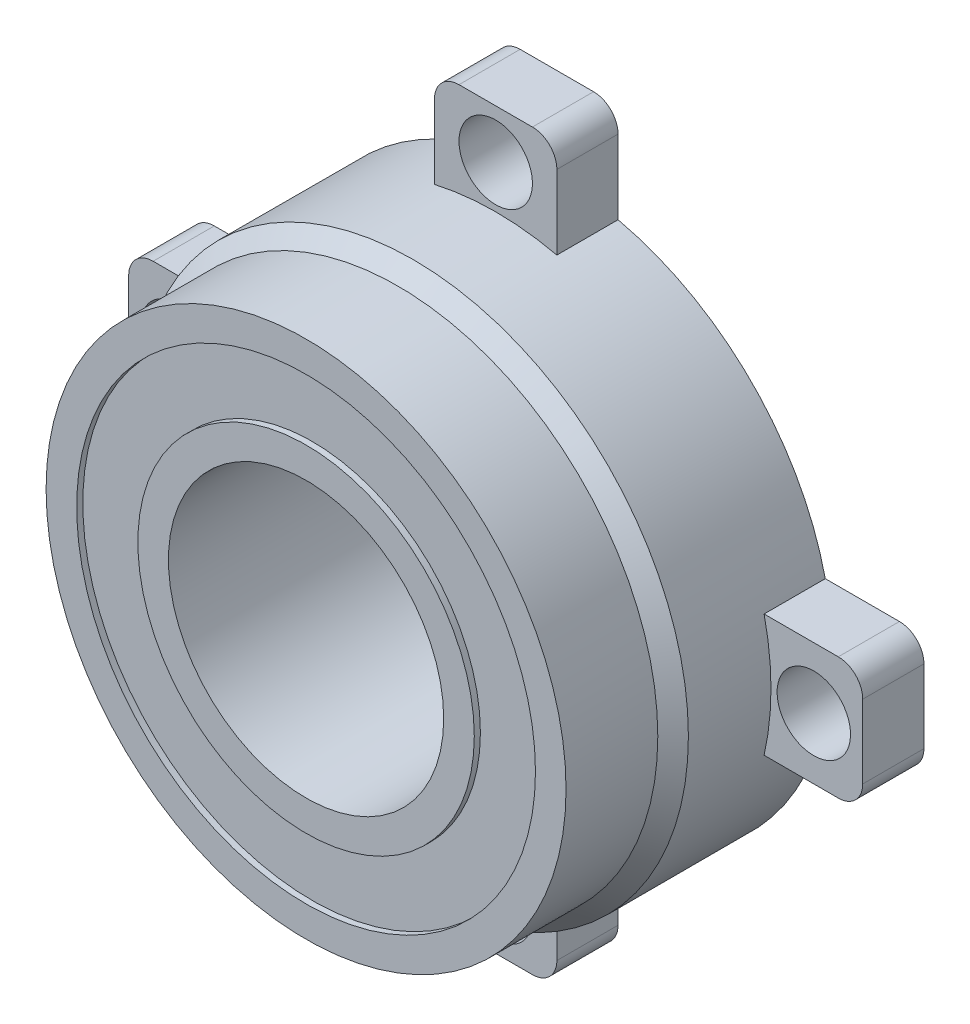
from build123d import *

# Parameters (mm, degrees)
SZKIC1_R                    = 45
SZKIC1_R_2                  = 22.5
DODANIE_WYCI_GNI_CIE1_DEPTH = 41
DODANIE_WYCI_GNI_CIE2_DEPTH = 10
SZKIC3_R                    = 6
WYTNIJ_WYCI_GNI_CIE1_DEPTH  = 10
SZYK_KO_OWY1_COUNT          = 4
WYTNIJ_WYCI_GNI_CIE2_START  = -20
SZKIC5_R                    = 45
SZKIC5_R_2                  = 42.5
WYTNIJ_WYCI_GNI_CIE2_DEPTH  = 20
SZKIC6_R                    = 37.5
SZKIC6_R_2                  = 27.5
WYTNIJ_WYCI_GNI_CIE3_DEPTH  = 1
SFAZOWANIE1_SIZE            = 5


with BuildPart() as part:
    # Szkic1 → Dodanie-wyciągnięcie1 (new body)
    with BuildSketch(Plane.XY):
        Circle(SZKIC1_R)
        Circle(SZKIC1_R_2, mode=Mode.SUBTRACT)
    extrude(amount=DODANIE_WYCI_GNI_CIE1_DEPTH)

    # Szkic2 → Dodanie-wyciągnięcie2 (add)
    with BuildSketch(Plane(origin=(0, 0, 0), x_dir=(-1, 0, 0), z_dir=(0, 0, -1))):
        with BuildLine():
            Line((35, 10), (56, 10))
            ThreePointArc((56, 10), (58.828427125, 8.828427125), (60, 6))
            Line((60, 6), (60, -6))
            ThreePointArc((60, -6), (58.828427125, -8.828427125), (56, -10))
            Line((56, -10), (35, -10))
            Line((35, -10), (35, 10))
        make_face()
        with BuildLine():
            Line((-10, 35), (10, 35))
            Line((10, 35), (10, 56))
            ThreePointArc((10, 56), (8.828427125, 58.828427125), (6, 60))
            Line((6, 60), (-6, 60))
            ThreePointArc((-6, 60), (-8.828427125, 58.828427125), (-10, 56))
            Line((-10, 56), (-10, 35))
        make_face()
        with BuildLine():
            Line((10, -35), (10, -56))
            ThreePointArc((10, -56), (8.828427125, -58.828427125), (6, -60))
            Line((6, -60), (-6, -60))
            ThreePointArc((-6, -60), (-8.828427125, -58.828427125), (-10, -56))
            Line((-10, -56), (-10, -35))
            Line((-10, -35), (10, -35))
        make_face()
        with BuildLine():
            Line((-35, -10), (-56, -10))
            ThreePointArc((-56, -10), (-58.828427125, -8.828427125), (-60, -6))
            Line((-60, -6), (-60, 6))
            ThreePointArc((-60, 6), (-58.828427125, 8.828427125), (-56, 10))
            Line((-56, 10), (-35, 10))
            Line((-35, 10), (-35, -10))
        make_face()
    extrude(amount=-DODANIE_WYCI_GNI_CIE2_DEPTH)

    # Szkic3 → Wytnij-wyciągnięcie1 (cut)
    with BuildSketch(Plane(origin=(0, 0, 0), x_dir=(-1, 0, 0), z_dir=(0, 0, -1))):
        with Locations((0, 52)):
            Circle(SZKIC3_R)
    wytnij_wyci_gni_cie1 = extrude(amount=-WYTNIJ_WYCI_GNI_CIE1_DEPTH, mode=Mode.SUBTRACT)

    # Szyk kołowy1: Wytnij-wyciągnięcie1 ×4 about axis
    szyk_ko_owy1_axis = Axis((0, 0, 0), (0, 0, 1))
    for i in range(1, SZYK_KO_OWY1_COUNT):
        add(wytnij_wyci_gni_cie1.rotate(szyk_ko_owy1_axis, i * 360 / SZYK_KO_OWY1_COUNT), mode=Mode.SUBTRACT)

    # Szkic5 → Wytnij-wyciągnięcie2 (cut)
    with BuildSketch(Plane.XY.offset(41).offset(WYTNIJ_WYCI_GNI_CIE2_START)):
        with Locations(Location((0, 0, 0), (0, 0, 167.160411593))):
            Circle(SZKIC5_R)
        Circle(SZKIC5_R_2, mode=Mode.SUBTRACT)
    extrude(amount=WYTNIJ_WYCI_GNI_CIE2_DEPTH, mode=Mode.SUBTRACT)

    # Szkic6 → Wytnij-wyciągnięcie3 (cut)
    with BuildSketch(Plane.XY.offset(41)):
        Circle(SZKIC6_R)
        Circle(SZKIC6_R_2, mode=Mode.SUBTRACT)
    extrude(amount=-WYTNIJ_WYCI_GNI_CIE3_DEPTH, mode=Mode.SUBTRACT)

    # Sfazowanie1
    # the kernel refuses this chamfer: 5 mm, written as the material it adds along each edge
    with BuildSketch(Plane(origin=(0, 0, 21), x_dir=(1, 0, 0), z_dir=(0, -1, 0))) as sfazowanie1_piece_1_section:
        Polygon((42.5 + SFAZOWANIE1_SIZE, 0), (42.5, SFAZOWANIE1_SIZE), (42.5, 0), align=None)
    sfazowanie1_piece_1 = revolve(axis=Axis((0, 0, 21), (0, 0, 1)), mode=Mode.PRIVATE)
    sfazowanie1_piece_1 = sfazowanie1_piece_1 & Plane(origin=(0, 0, 24.721078182), x_dir=(1, 0, 0), z_dir=(0, 0, -1)) * Cylinder(45, 190, mode=Mode.PRIVATE)
    add(sfazowanie1_piece_1)


solid = part.part
